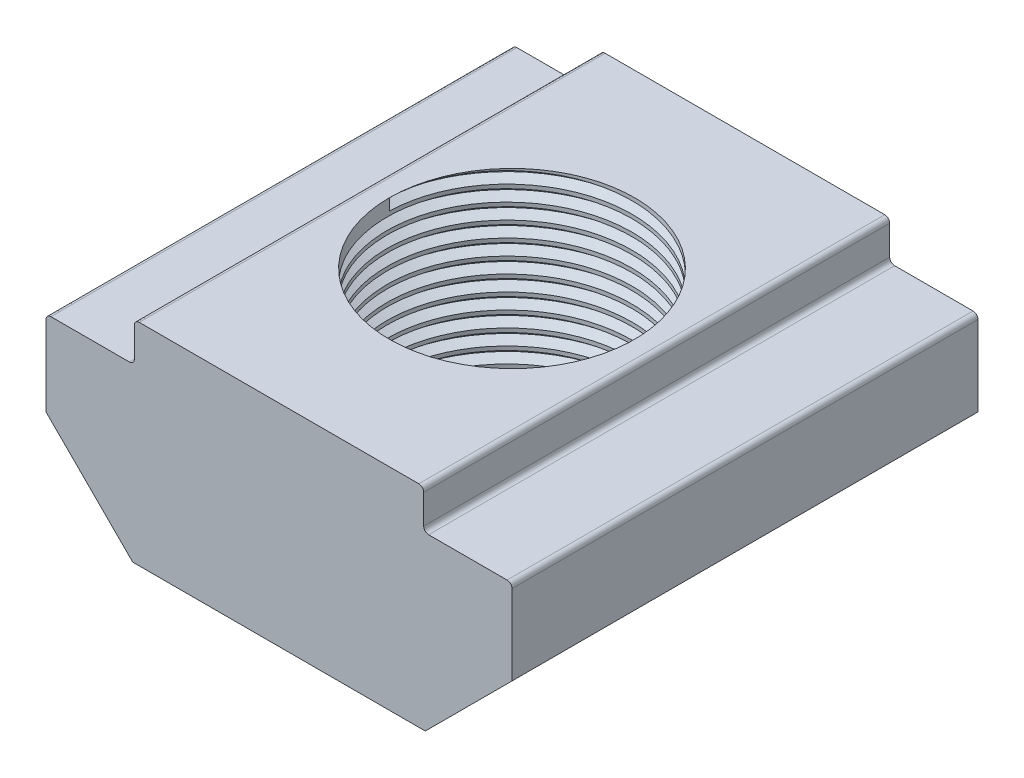
from build123d import *

# Parameters (mm, degrees)
EXTRUDE_1_DEPTH = 9.5
F_5_0MM_1_D     = 5
THREAD_1_PITCH  = 0.3175
FILLET_1_R      = 0.1


with BuildPart() as part:
    # Sketch 1 → 凸台-拉伸1 (new body)
    with BuildSketch(Plane.XY):
        Polygon((2.982233047, 0), (-2.982233047, 0), (-4.75, 1.767766953), (-4.75, 3.5), (-2.95, 3.5), (-2.95, 4.3), (2.95, 4.3), (2.95, 3.5), (4.75, 3.5), (4.75, 1.767766953), align=None)
    extrude(amount=-EXTRUDE_1_DEPTH)

    # Ø5.0mm 暗销孔1 (through all)
    with Locations(Plane(origin=(0, 4.3, 0), x_dir=(1, 0, 0), z_dir=(0, 1, 0))):
        with Locations((0, 4.75)):
            Hole(F_5_0MM_1_D / 2)

    # 螺纹线1: the profile of Sketch 1 2 profile screwed along a right-hand helix of 13.543307 turns, 6 arcs to a turn; built about Z, then put on its axis
    thread_1_z = Axis((0, 0, 0), (0, 0, 1))
    thread_1_corners = [(2.4997, 0, -0.000173205), (2.671851915, 0, 0.09921875), (2.671851915, 0, 0.13890625), (2.4997, 0, 0.238298204)]
    with BuildLine(mode=Mode.PRIVATE) as thread_1_profile:
        Line(thread_1_corners[0], thread_1_corners[1])
        Line(thread_1_corners[1], thread_1_corners[2])
        Line(thread_1_corners[2], thread_1_corners[3])
        Line(thread_1_corners[3], thread_1_corners[0])
    thread_1_cap = Face(thread_1_profile.wire())
    thread_1_turn_angles = [0, 30, 60, 90, 120, 150, 180, 210, 240, 270, 300, 330, 360]
    thread_1_turn_weights = [1, 0.8660254037844387, 1, 0.8660254037844387, 1, 0.8660254037844387, 1, 0.8660254037844387, 1, 0.8660254037844387, 1, 0.8660254037844387, 1]
    thread_1_turn_rails = [Edge.make_bspline([Vector(p[0], p[1], 0).rotate(thread_1_z, thread_1_turn_angles[k]) / thread_1_turn_weights[k] + Vector(0, 0, p[2] + THREAD_1_PITCH * thread_1_turn_angles[k] / 360) for k in range(13)], [0, 0, 0, 1, 1, 2, 2, 3, 3, 4, 4, 5, 5, 6, 6, 6], 2, thread_1_turn_weights) for p in thread_1_corners]
    thread_1_turn_sides = [Face.make_surface_from_curves(thread_1_turn_rails[p[0]], thread_1_turn_rails[p[1]]) for p in [(0, 1), (1, 2), (2, 3), (3, 0)]]
    thread_1_last_angles = [4680, 4710, 4740, 4770, 4800, 4830, 4860, 4867.795275591, 4875.590551181]
    thread_1_last_weights = [1, 0.8660254037844387, 1, 0.8660254037844387, 1, 0.8660254037844387, 1, 0.990759027734459, 1]
    thread_1_last_rails = [Edge.make_bspline([Vector(p[0], p[1], 0).rotate(thread_1_z, thread_1_last_angles[k]) / thread_1_last_weights[k] + Vector(0, 0, p[2] + THREAD_1_PITCH * thread_1_last_angles[k] / 360) for k in range(9)], [0, 0, 0, 1, 1, 2, 2, 3, 3, 4, 4, 4], 2, thread_1_last_weights) for p in thread_1_corners]
    thread_1_last_sides = [Face.make_surface_from_curves(thread_1_last_rails[p[0]], thread_1_last_rails[p[1]]) for p in [(0, 1), (1, 2), (2, 3), (3, 0)]]
    thread_1 = Plane(origin=(0, 4.3, -4.75), x_dir=(-1, 0, 0), z_dir=(0, -1, 0)) * Solid(Shell([*[p.moved(Location((0, 0, THREAD_1_PITCH * i))) for i in range(13) for p in thread_1_turn_sides], *thread_1_last_sides, thread_1_cap, thread_1_cap.rotate(thread_1_z, 4875.590551181).moved(Location((0, 0, THREAD_1_PITCH * 4875.590551181 / 360)))]))
    add(thread_1, mode=Mode.SUBTRACT)

    # 圆角1
    fillet_1_edges = [part.edges().sort_by_distance(p)[0] for p in [
        (-4.75, 3.5, -4.75),
        (-2.95, 3.5, -4.75),
        (-2.95, 4.3, -4.75),
        (2.95, 4.3, -4.75),
        (2.95, 3.5, -4.75),
        (4.75, 3.5, -4.75),
    ]]
    fillet(fillet_1_edges, radius=FILLET_1_R)


solid = part.part
